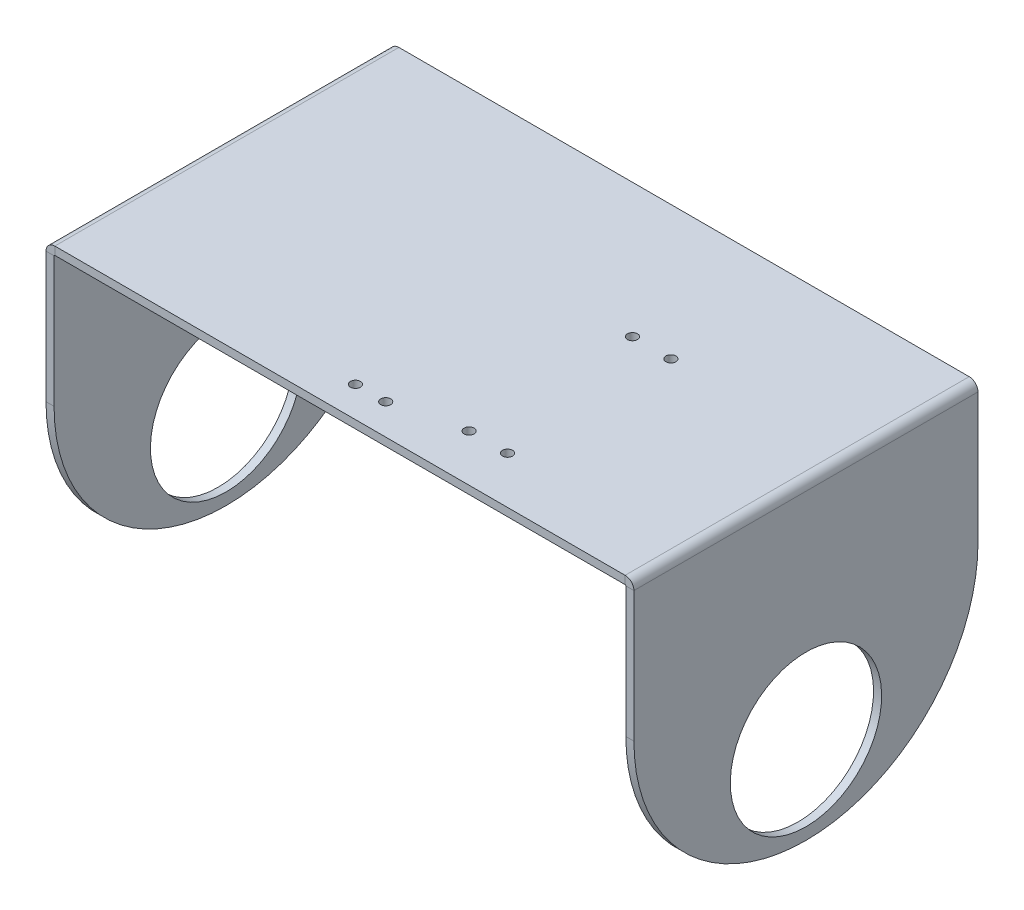
from build123d import *

# Parameters (mm, degrees)
SKETCH2_W                      = 582.8
SKETCH2_H                      = 341.07
BASE_FLANGE5_DEPTH             = 8
EDGE_FLANGE2_STRIP_W           = 33.4732
EDGE_FLANGE2_STRIP_H           = 8
EDGE_FLANGE2_STRIP_CUT_DEPTH   = 341.07
EDGE_FLANGE2_STRIP_2_W         = 33.4732
EDGE_FLANGE2_STRIP_2_H         = 8
EDGE_FLANGE2_STRIP_CUT_2_DEPTH = 341.07
EDGE_FLANGE2_DEPTH             = 341.07
EDGE_FLANGE2_BEND_DEPTH        = 341.07
BOSS_EXTRUDE4_DEPTH            = 4
F_10_0MM_DOWEL_HOLE1_D         = 10
BOSS_EXTRUDE5_DEPTH            = 4
CUT_EXTRUDE2_DEPTH             = 743.413921694
CUT_EXTRUDE2_DEPTH_BACK        = 743.413921694
SKETCH40_R                     = 75
F_10_0MM_DOWEL_HOLE2_D         = 10
F_10_0MM_DOWEL_HOLE3_D         = 10


# Sheet-metal steps are written as plain solids
with BuildPart() as part:
    # Sketch2 → Base-Flange5 (new body)
    with BuildSketch(Plane(origin=(0, 0, 0), x_dir=(1, 0, 0), z_dir=(0, 1, 0))):
        with Locations((291.4, 170.535)):
            Rectangle(SKETCH2_W, SKETCH2_H)
    extrude(amount=-BASE_FLANGE5_DEPTH)

    # Edge-Flange2 strip (across the edge) → Edge-Flange2 strip cut (cut)
    with BuildSketch(Plane(origin=(0, -8, 0), x_dir=(1, 0, 0), z_dir=(0, 0, -1))):
        with Locations((-8, -4)):
            Rectangle(EDGE_FLANGE2_STRIP_W, EDGE_FLANGE2_STRIP_H)
    extrude(amount=EDGE_FLANGE2_STRIP_CUT_DEPTH, mode=Mode.SUBTRACT)

    # Edge-Flange2 strip 2 (across the edge) → Edge-Flange2 strip cut 2 (cut)
    with BuildSketch(Plane(origin=(582.8, -8, -341.07), x_dir=(-1, 0, 0), z_dir=(0, 0, 1))):
        with Locations((-8, -4)):
            Rectangle(EDGE_FLANGE2_STRIP_2_W, EDGE_FLANGE2_STRIP_2_H)
    extrude(amount=EDGE_FLANGE2_STRIP_CUT_2_DEPTH, mode=Mode.SUBTRACT)

    # Edge-Flange2 section (across the edge) → Edge-Flange2 (add)
    with BuildSketch(Plane(origin=(0, -8, 0), x_dir=(1, 0, 0), z_dir=(0, 0, -1))):
        with BuildLine():
            Line((0, 0.7366), (0, 130))
            Line((0, 130), (8, 130))
            Line((8, 130), (8, 0.7366))
            ThreePointArc((8, 0.7366), (8.215745145, 0.215745145), (8.7366, 0))
            Line((8.7366, 0), (8.7366, -8))
            ThreePointArc((8.7366, -8), (2.558890895, -5.441109105), (0, 0.7366))
        make_face()
    extrude(amount=EDGE_FLANGE2_DEPTH)

    # Edge-Flange2 section 2 (across the edge) → Edge-Flange2 bend (add)
    with BuildSketch(Plane(origin=(582.8, -8, -341.07), x_dir=(-1, 0, 0), z_dir=(0, 0, 1))):
        with BuildLine():
            Line((0, 0.7366), (0, 130))
            Line((0, 130), (8, 130))
            Line((8, 130), (8, 0.7366))
            ThreePointArc((8, 0.7366), (8.215745145, 0.215745145), (8.7366, 0))
            Line((8.7366, 0), (8.7366, -8))
            ThreePointArc((8.7366, -8), (2.558890895, -5.441109105), (0, 0.7366))
        make_face()
    extrude(amount=EDGE_FLANGE2_BEND_DEPTH)

    # Sketch39 → Boss-Extrude4 (add, symmetric)
    with BuildSketch(Plane.ZY.offset(-4)):
        with BuildLine():
            Line((-341.07, -138), (0, -138))
            ThreePointArc((0, -138), (-170.535, -308.535), (-341.07, -138))
        make_face()
    extrude(amount=BOSS_EXTRUDE4_DEPTH, both=True)

    # Ø10.0mm Dowel Hole1 (through all)
    with Locations(Plane(origin=(306.4, 0, -30.31), x_dir=(0, 0, 1), z_dir=(0, 1, 0))):
        with Locations((0, 0), (0, -30)):
            Hole(F_10_0MM_DOWEL_HOLE1_D / 2)

    # Sketch46 → Boss-Extrude5 (add, symmetric)
    with BuildSketch(Plane(origin=(578.8, 0, 0), x_dir=(0, 0, -1), z_dir=(1, 0, 0))):
        with BuildLine():
            Line((0, -138), (341.07, -138))
            ThreePointArc((341.07, -138), (170.535, -308.535), (0, -138))
        make_face()
    extrude(amount=BOSS_EXTRUDE5_DEPTH, both=True)

    # Sketch40 → Cut-Extrude2 (cut, two sides: drawn at the far end of the back side and taken through both)
    with BuildSketch(Plane.ZY.offset(-CUT_EXTRUDE2_DEPTH_BACK)):
        with Locations(Location((-170.535, -221.773804428, 0), (0, 0, 270))):
            Circle(SKETCH40_R)
    extrude(amount=CUT_EXTRUDE2_DEPTH + CUT_EXTRUDE2_DEPTH_BACK, mode=Mode.SUBTRACT)

    # Ø10.0mm Dowel Hole2 (through all)
    with Locations(Plane(origin=(372.86, 0, -46.56), x_dir=(0, 0, 1), z_dir=(0, 1, 0))):
        with Locations((0, 0), (0, 38.08)):
            Hole(F_10_0MM_DOWEL_HOLE2_D / 2)

    # Ø10.0mm Dowel Hole3 (through all)
    with Locations(Plane(origin=(410.94, 0, -208.49), x_dir=(0, 0, 1), z_dir=(0, 1, 0))):
        with Locations((0, 0), (0, -38.08)):
            Hole(F_10_0MM_DOWEL_HOLE3_D / 2)


solid = part.part
